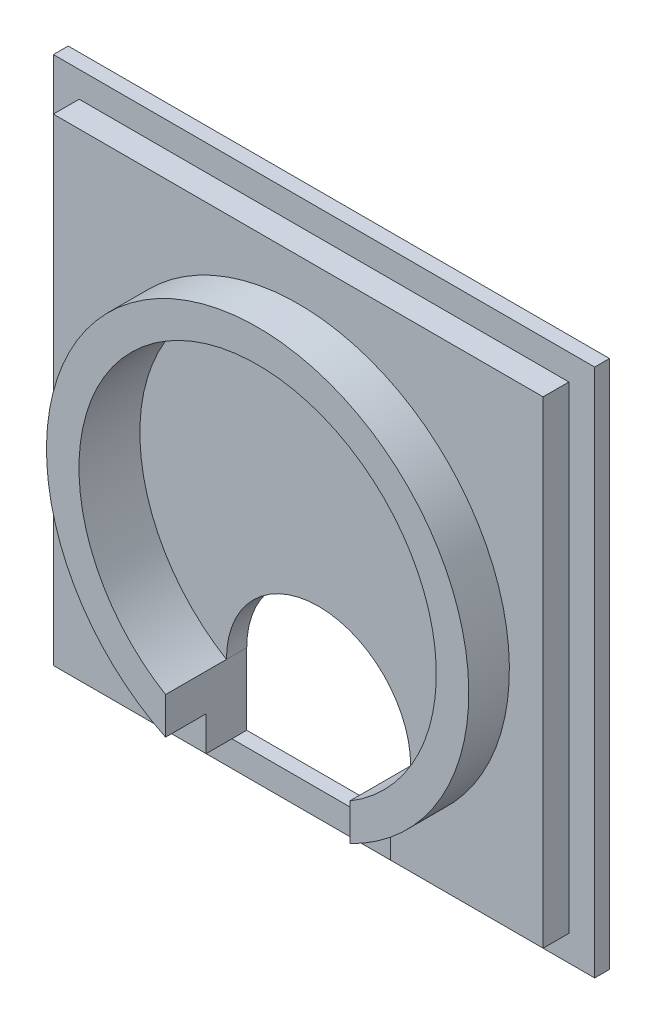
from build123d import *
from build123d.topology import SkipClean

# Parameters (mm, degrees)
SKETCH16_W           = 60.3
SKETCH16_H           = 58.8
SKETCH16_R           = 22
BOSS_EXTRUDE2_DEPTH  = 5
SKETCH22_W           = 60.3
SKETCH22_H           = 2.5
BOSS_EXTRUDE7_DEPTH  = 50
BOSS_EXTRUDE8_START  = 5
BOSS_EXTRUDE8_DEPTH  = 5
SKETCH27_W           = 66.65
SKETCH27_H           = 65.15
BOSS_EXTRUDE10_DEPTH = 1.825
CUT_EXTRUDE3_DEPTH   = 26.375


with BuildPart() as part:
    # Sketch16 → Boss-Extrude2 (new body)
    with BuildSketch(Plane.XY):
        with Locations((0, 1.75)):
            Rectangle(SKETCH16_W, SKETCH16_H)
        Circle(SKETCH16_R, mode=Mode.SUBTRACT)
    extrude(amount=-BOSS_EXTRUDE2_DEPTH)

    # Sketch22 → Boss-Extrude7 (add)
    with BuildSketch(Plane(origin=(0, 31.15, 0), x_dir=(1, 0, 0), z_dir=(0, 1, 0))):
        with Locations((0, 3.75)):
            Rectangle(SKETCH22_W, SKETCH22_H)
    extrude(amount=-BOSS_EXTRUDE7_DEPTH)

    # Sketch23 → Boss-Extrude8 (add)
    with SkipClean():  # the faces are left unmerged after this step: merging them gives an invalid solid
        with BuildSketch(Plane.XY.offset(BOSS_EXTRUDE8_START)):
            with BuildLine():
                ThreePointArc((26, 0), (-13.803371437, 22.033314253), (-11.343610536, -23.394924663))
                Line((-11.343610536, -23.394924663), (-11.343610536, -18.85))
                ThreePointArc((-11.343610536, -18.85), (-10.826831674, 19.151493829), (22, 0))
                Line((22, 0), (22, -13.856406461))
                ThreePointArc((22, -13.856406461), (24.979991994, -7.211102551), (26, 0))
            make_face()
            with BuildLine():
                Line((11.343610536, -18.85), (11.343610536, -23.394924663))
                ThreePointArc((11.343610536, -23.394924663), (17.340557179, -19.372792177), (22, -13.856406461))
                Line((22, -13.856406461), (22, 0))
                ThreePointArc((22, 0), (19.151493829, -10.826831674), (11.343610536, -18.85))
            make_face()
        extrude(amount=-BOSS_EXTRUDE8_DEPTH)

    # Sketch27 → Boss-Extrude10 (add)
    with SkipClean():  # the faces are left unmerged after this step: merging them gives an invalid solid
        with BuildSketch(Plane.XY.offset(-3.175)):
            with Locations((0, 1.75)):
                Rectangle(SKETCH27_W, SKETCH27_H)
        extrude(amount=-BOSS_EXTRUDE10_DEPTH)

    # Sketch24 → Cut-Extrude3 (cut, symmetric)
    with SkipClean():  # the faces are left unmerged after this step: merging them gives an invalid solid
        with BuildSketch(Plane.XY.offset(-2.5)):
            with BuildLine():
                Line((-11.343610536, -18.85), (-11.343610536, -27.65))
                Line((-11.343610536, -27.65), (11.343610536, -27.65))
                Line((11.343610536, -27.65), (11.343610536, -18.85))
                ThreePointArc((11.343610536, -18.85), (0, -7.506389464), (-11.343610536, -18.85))
            make_face()
        extrude(amount=CUT_EXTRUDE3_DEPTH, both=True, mode=Mode.SUBTRACT)


solid = part.part
